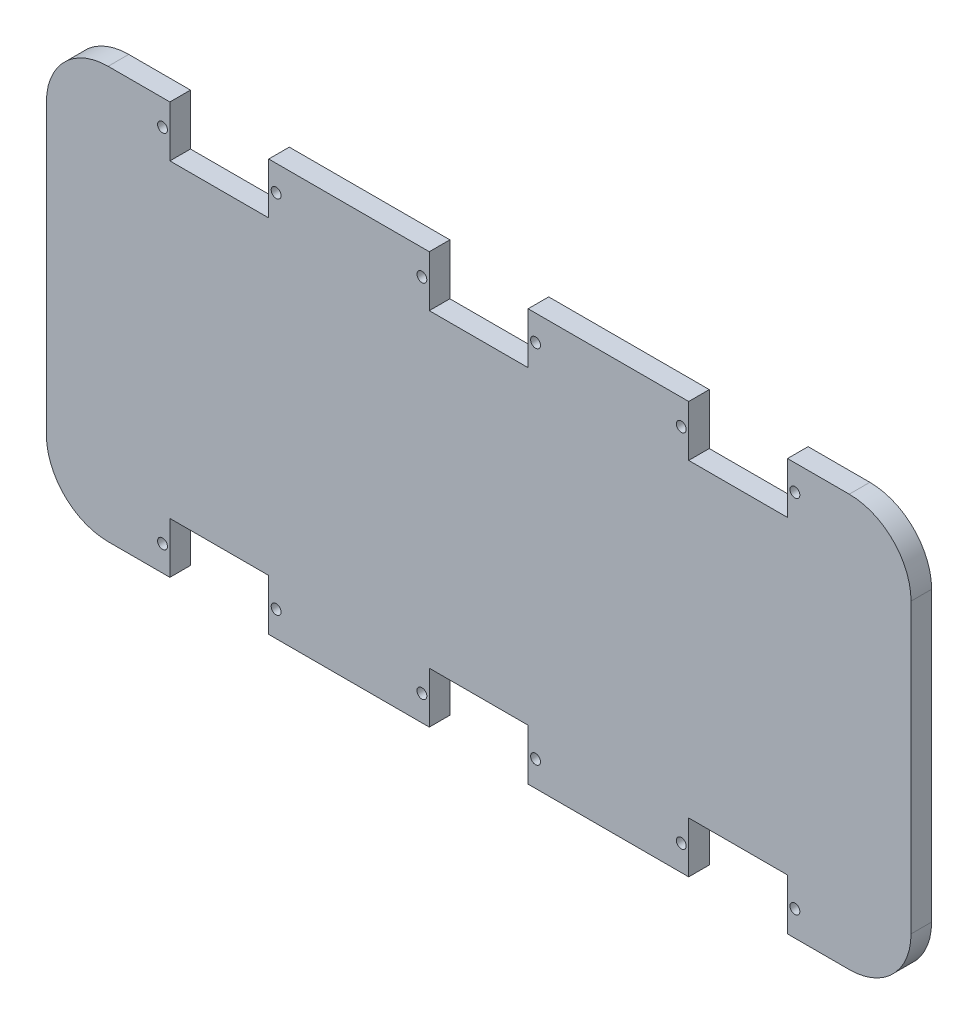
from build123d import *

# Parameters (mm, degrees)
BOSS_EXTRUDE2_DEPTH = 5
SKETCH2_W           = 24
SKETCH2_H           = 12.4
CUT_EXTRUDE1_DEPTH  = 5
SKETCH3_R           = 1.2
CUT_EXTRUDE2_DEPTH  = 5


with BuildPart() as part:
    # Sketch1 → Boss-Extrude2 (new body)
    with BuildSketch(Plane.XY):
        with BuildLine():
            Line((-90, -50), (90, -50))
            ThreePointArc((90, -50), (100.606601718, -45.606601718), (105, -35))
            Line((105, -35), (105, 35))
            ThreePointArc((105, 35), (100.606601718, 45.606601718), (90, 50))
            Line((90, 50), (-90, 50))
            ThreePointArc((-90, 50), (-100.606601718, 45.606601718), (-105, 35))
            Line((-105, 35), (-105, -35))
            ThreePointArc((-105, -35), (-100.606601718, -45.606601718), (-90, -50))
        make_face()
    extrude(amount=BOSS_EXTRUDE2_DEPTH)

    # Sketch2 → Cut-Extrude1 (cut)
    with BuildSketch(Plane.XY.offset(5)):
        with Locations((63, -43.8)):
            Rectangle(SKETCH2_W, SKETCH2_H)
        with Locations((-63, 43.8)):
            Rectangle(SKETCH2_W, SKETCH2_H)
        with Locations((0, 43.8)):
            Rectangle(SKETCH2_W, SKETCH2_H)
        with Locations((63, 43.8)):
            Rectangle(SKETCH2_W, SKETCH2_H)
        with Locations((0, -43.8)):
            Rectangle(SKETCH2_W, SKETCH2_H)
        with Locations((-63, -43.8)):
            Rectangle(SKETCH2_W, SKETCH2_H)
    extrude(amount=-CUT_EXTRUDE1_DEPTH, mode=Mode.SUBTRACT)

    # Sketch3 → Cut-Extrude2 (cut)
    with BuildSketch(Plane.XY.offset(5)):
        with Locations((-76.8, 43.8)):
            Circle(SKETCH3_R)
        with Locations((-49.2, 43.8)):
            Circle(SKETCH3_R)
        with Locations((-13.8, 43.8)):
            Circle(SKETCH3_R)
        with Locations((13.8, 43.8)):
            Circle(SKETCH3_R)
        with Locations((49.2, 43.8)):
            Circle(SKETCH3_R)
        with Locations((76.8, 43.8)):
            Circle(SKETCH3_R)
        with Locations((-76.8, -43.8)):
            Circle(SKETCH3_R)
        with Locations((-49.2, -43.8)):
            Circle(SKETCH3_R)
        with Locations((-13.8, -43.8)):
            Circle(SKETCH3_R)
        with Locations((13.8, -43.8)):
            Circle(SKETCH3_R)
        with Locations((49.2, -43.8)):
            Circle(SKETCH3_R)
        with Locations((76.8, -43.8)):
            Circle(SKETCH3_R)
    extrude(amount=-CUT_EXTRUDE2_DEPTH, mode=Mode.SUBTRACT)


solid = part.part
